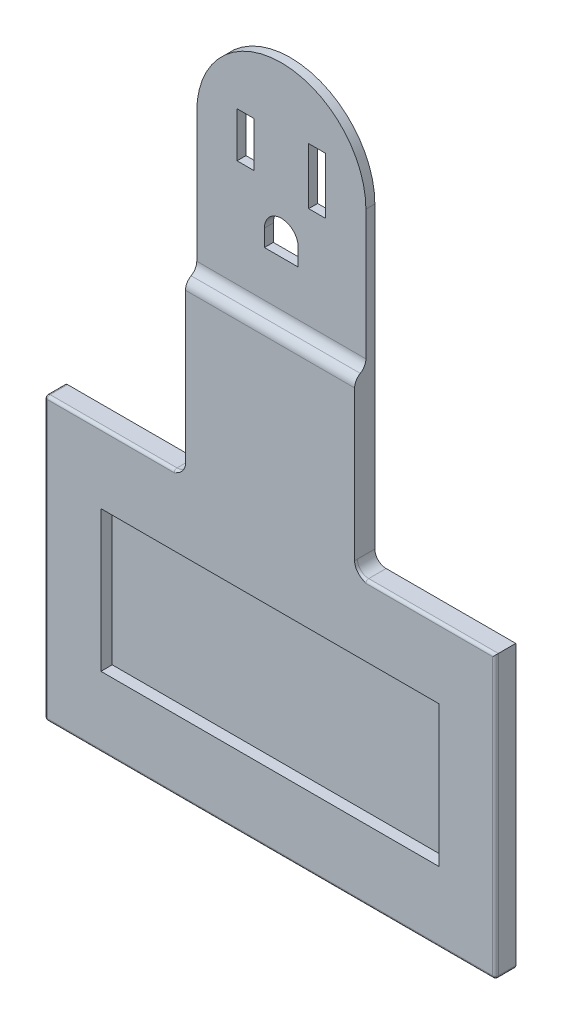
from build123d import *

# Parameters (mm, degrees)
SKETCH1_W                = 3
SKETCH1_H                = 10
SKETCH1_H_2              = 8
BOSS_EXTRUDE1_DEPTH      = 1.5875
BOSS_EXTRUDE2_DEPTH      = 40
BOSS_EXTRUDE2_DEPTH_BACK = 40
SKETCH3_W                = 2
SKETCH3_H                = 50
SKETCH3_W_2              = 1.5875
SKETCH6_W                = 2
SKETCH6_H                = 30
BOSS_EXTRUDE3_DEPTH      = 30
SKETCH4_W                = 60
SKETCH4_H                = 25
CUT_EXTRUDE1_DEPTH       = 2
FILLET3_R                = 0.5
FILLET5_R                = 2
FILLET6_R                = 2


with BuildPart() as part:
    # Sketch1 → Boss-Extrude1 (new body)
    with BuildSketch(Plane.XY):
        with BuildLine():
            Line((29.372040361, -4.693897293), (29.372040361, -59.693897293))
            Line((29.372040361, -59.693897293), (-0.627959639, -59.693897293))
            Line((-0.627959639, -59.693897293), (-0.627959639, -4.693897293))
            ThreePointArc((-0.627959639, -4.693897293), (14.372040361, 10.306102707), (29.372040361, -4.693897293))
        make_face()
        with Locations((20.722040361, -4.693897293)):
            Rectangle(SKETCH1_W, SKETCH1_H, mode=Mode.SUBTRACT)
        with Locations((8.022040361, -4.693897293)):
            Rectangle(SKETCH1_W, SKETCH1_H_2, mode=Mode.SUBTRACT)
        with BuildLine():
            ThreePointArc((17.372040361, -16.593897293), (14.372040361, -13.593897293), (11.372040361, -16.593897293))
            Line((11.372040361, -16.593897293), (11.372040361, -19.593897293))
            Line((11.372040361, -19.593897293), (17.372040361, -19.593897293))
            Line((17.372040361, -19.593897293), (17.372040361, -16.593897293))
        make_face(mode=Mode.SUBTRACT)
    extrude(amount=BOSS_EXTRUDE1_DEPTH)

    # Sketch3 → Boss-Extrude2 (add, two sides: drawn at the far end of the back side and taken through both)
    with BuildSketch(Plane(origin=(14.372040361, 0, 0), x_dir=(0, 0, -1), z_dir=(1, 0, 0)).offset(-BOSS_EXTRUDE2_DEPTH_BACK)):
        with Locations((-2.5875, -84.693897293)):
            Rectangle(SKETCH3_W, SKETCH3_H)
        with Locations((-0.79375, -84.693897293)):
            Rectangle(SKETCH3_W_2, SKETCH3_H)
    extrude(amount=BOSS_EXTRUDE2_DEPTH + BOSS_EXTRUDE2_DEPTH_BACK)

    # Sketch6 → Boss-Extrude3 (add)
    with BuildSketch(Plane(origin=(29.372040361, 0, 0), x_dir=(0, 0, -1), z_dir=(1, 0, 0))):
        with Locations((-2.5875, -44.693897293)):
            Rectangle(SKETCH6_W, SKETCH6_H)
    extrude(amount=-BOSS_EXTRUDE3_DEPTH)

    # Sketch4 → Cut-Extrude1 (cut)
    with BuildSketch(Plane.XY.offset(3.5875)):
        with Locations((14.372040361, -84.693897293)):
            Rectangle(SKETCH4_W, SKETCH4_H)
    extrude(amount=-CUT_EXTRUDE1_DEPTH, mode=Mode.SUBTRACT)

    # Fillet3
    fillet3_edges = [part.edges().sort_by_distance(p)[0] for p in [
        (-13.127959639, -59.693897293, 3.5875),
        (54.372040361, -109.693897293, 1.79375),
        (14.372040361, -109.693897293, 3.5875),
        (54.372040361, -84.693897293, 3.5875),
        (-25.627959639, -59.693897293, 1.79375),
        (-25.627959639, -109.693897293, 1.79375),
        (-25.627959639, -84.693897293, 3.5875),
        (41.872040361, -59.693897293, 3.5875),
    ]]
    fillet(fillet3_edges, radius=FILLET3_R)

    # Fillet5
    # the kernel refuses this fillet: 2 mm, written as the material it adds along each edge
    with BuildSketch(Plane(origin=(-0.627959639, -60.193897293, 3.0875), x_dir=(0, 1, 0), z_dir=(0, 0, -1))) as fillet5_piece_1_section:
        with BuildLine():
            CenterArc((0.5 + FILLET5_R, -FILLET5_R), FILLET5_R, 90, 90)
            Line((0.5 + FILLET5_R, 0), (0.5, 0))
            Line((0.5, 0), (0.5, -FILLET5_R))
        make_face()
    fillet5_piece_1 = revolve(axis=Axis((-0.627959639, -60.193897293, 3.0875), (1, 0, 0)), revolution_arc=359.64, mode=Mode.PRIVATE)
    fillet5_piece_1 = split(fillet5_piece_1, bisect_by=Plane(origin=(-1.414331511, -59.810829733, 3.5875), z_dir=(0, 0, -1)), keep=Keep.TOP, mode=Mode.PRIVATE)
    add(fillet5_piece_1)
    with BuildSketch(Plane(origin=(29.372040361, -60.193897293, 3.0875), x_dir=(0, 0.9999802608561372, -0.006283143965558423), z_dir=(0, 0.006283143965558423, 0.9999802608561372))) as fillet5_piece_2_section:
        with BuildLine():
            CenterArc((-0.5 - FILLET5_R, -FILLET5_R), FILLET5_R, 0, 90)
            Line((-0.5, -FILLET5_R), (-0.5, 0))
            Line((-0.5, 0), (-0.5 - FILLET5_R, 0))
        make_face()
    fillet5_piece_2 = revolve(axis=Axis((29.372040361, -60.193897293, 3.0875), (-1, 0, 0)), revolution_arc=359.64, mode=Mode.PRIVATE)
    fillet5_piece_2 = split(fillet5_piece_2, bisect_by=Plane(origin=(30.158412419, -59.810829718, 3.5875), z_dir=(0, 0, -1)), keep=Keep.TOP, mode=Mode.PRIVATE)
    add(fillet5_piece_2)
    with BuildSketch(Plane(origin=(29.372040361, -29.693897293, 1.5875), x_dir=(0, 0, 1), z_dir=(-1, 0, 0))) as fillet5_piece_3:
        with BuildLine():
            CenterArc((FILLET5_R, FILLET5_R), FILLET5_R, 180, 90)
            Line((0, FILLET5_R), (0, 0))
            Line((0, 0), (FILLET5_R, 0))
        make_face()
    extrude(amount=30)
    with BuildSketch(Plane(origin=(-0.627959639, -59.693897293, 3.0875), x_dir=(-1, 0, 0), z_dir=(0, 0, -1))) as fillet5_piece_4:
        with BuildLine():
            CenterArc((FILLET5_R, FILLET5_R), FILLET5_R, 180, 90)
            Line((0, FILLET5_R), (0, 0))
            Line((0, 0), (FILLET5_R, 0))
        make_face()
    extrude(amount=3.0875)
    with BuildSketch(Plane(origin=(29.372040361, -59.693897293, 0), x_dir=(0, 1, 0), z_dir=(0, 0, 1))) as fillet5_piece_5:
        with BuildLine():
            CenterArc((FILLET5_R, -FILLET5_R), FILLET5_R, 90, 90)
            Line((0, -FILLET5_R), (0, 0))
            Line((0, 0), (FILLET5_R, 0))
        make_face()
    extrude(amount=3.0875)

    # Fillet6
    fillet6_edges = [part.edges().sort_by_distance(p)[0] for p in [
        (14.372040361, -29.693897293, 3.5875),
    ]]
    fillet(fillet6_edges, radius=FILLET6_R)


solid = part.part
